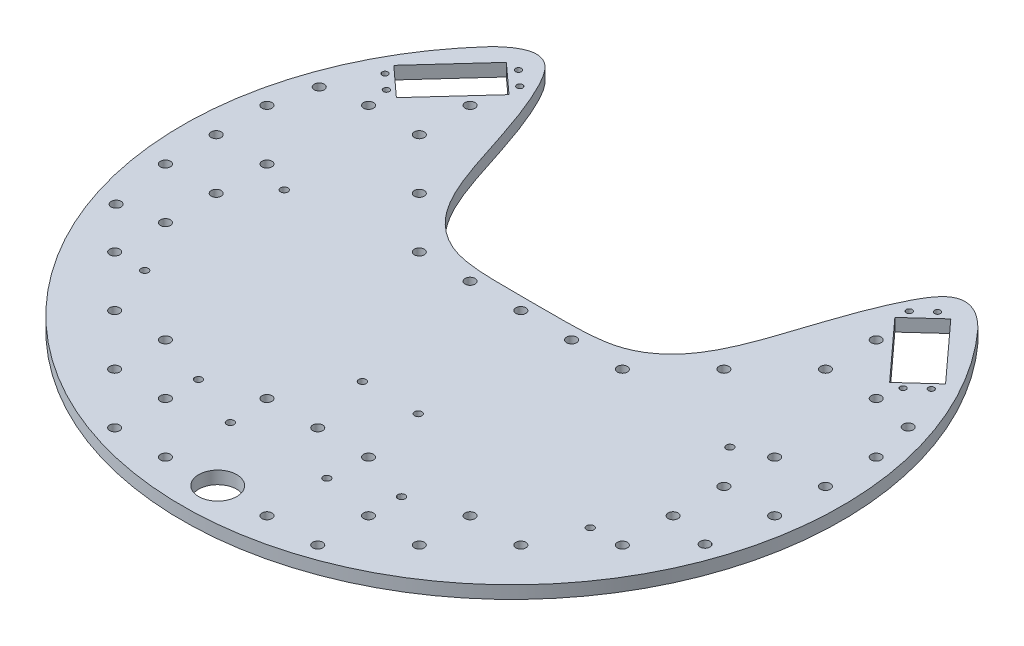
from build123d import *

# Parameters (mm, degrees)
SKETCH1_R                      = 164.975
BOSS_EXTRUDE1_DEPTH            = 6.35
F_6_CLEARANCE_HOLE1_D          = 3.6576
CUT_EXTRUDE1_START             = -6.35
CUT_EXTRUDE1_DEPTH             = 6.35
F_6_CLEARANCE_HOLE2_D          = 3.6576
F_6_CLEARANCE_HOLE2_DEPTH      = 25.4
F_6_CLEARANCE_HOLE2_TIP        = 1.0988539
F_10_CLEARANCE_HOLE3_D         = 4.9784
CUT_EXTRUDE2_DEPTH             = 234.396280641
F_4_CLEARANCE_HOLE1_AT_2_COUNT = 2
F_4_CLEARANCE_HOLE1_AT_2_PITCH = 10
F_4_CLEARANCE_HOLE1_AT_3_COUNT = 2
F_4_CLEARANCE_HOLE1_AT_3_PITCH = 48.306392952
F_4_CLEARANCE_HOLE1_AT_4_COUNT = 2
F_4_CLEARANCE_HOLE1_AT_4_PITCH = 47.26
F_6_CLEARANCE_HOLE5_D          = 3.6576
F_6_CLEARANCE_HOLE5_DEPTH      = 9.906
F_6_CLEARANCE_HOLE5_TIP        = 1.0988539
LPATTERN1_COUNT                = 7
LPATTERN1_PITCH                = 25.4
LPATTERN1_COUNT_DIR2           = 7
LPATTERN1_PITCH_DIR2           = 25.4
LPATTERN3_COUNT                = 4
LPATTERN3_PITCH                = 25.4
LPATTERN3_COUNT_DIR2           = 7
LPATTERN3_PITCH_DIR2           = 25.4
SKETCH26_R                     = 9.525
CUT_EXTRUDE3_DEPTH             = 234.396280641


# Read off the part's stored shape, not the designer's step: Cut-Extrude1
with BuildPart() as part:
    # Sketch1 → Boss-Extrude1 (new body)
    with BuildSketch(Plane(origin=(0, 0, 0), x_dir=(1, 0, 0), z_dir=(0, 1, 0))):
        with Locations(Location((0, 0, 0), (0, 0, 270))):
            Circle(SKETCH1_R)
    extrude(amount=BOSS_EXTRUDE1_DEPTH)

    # #6 Clearance Hole1 (through all)
    with Locations(Plane(origin=(111.465, 0, 2.54), x_dir=(0, 0, -1), z_dir=(0, -1, 0))):
        with Locations((0, 0), (-69.85, 0), (-69.85, -222.93), (0, -222.93)):
            Hole(F_6_CLEARANCE_HOLE1_D / 2)

    # Cut-Extrude1 outline → Cut-Extrude1 (cut)
    with BuildSketch(Plane(origin=(0, 6.35, 0), x_dir=(1, 0, 0), z_dir=(0, 1, 0)).offset(CUT_EXTRUDE1_START)):
        with BuildLine():
            add(Edge.make_bspline(
                [(-121.995341632, 111.058035482), (-113.827078604, 119.195529615), (-102.201033376, 123.818897159), (-77.69847521, 78.016737099), (-72.90657281, 34.879062258), (-40.627849609, 10.287477897), (-25.130427141, 10.681054333), (25.130427141, 10.681054333), (40.627849609, 10.287477897), (72.90657281, 34.879062258), (77.69847521, 78.016737099), (102.201033376, 123.818897159), (113.827078604, 119.195529615), (121.995341632, 111.058035482)],
                knots=[0, 0, 0, 0, 0.147171476, 0.22252378, 0.623698123, 0.698492612, 0.920321881, 0.920321881, 1.14215115, 1.216945639, 1.618119982, 1.693472286, 1.840643762, 1.840643762, 1.840643762, 1.840643762], degree=3))
            ThreePointArc((121.995341632, 111.058035482), (0, 164.975), (-121.995341632, 111.058035482))
        make_face()
    extrude(amount=CUT_EXTRUDE1_DEPTH, mode=Mode.SUBTRACT)

    # #6 Clearance Hole2
    with Locations(Plane(origin=(50.8, 6.35, 106.158945667), x_dir=(0, 0, 1), z_dir=(0, 1, 0))):
        with Locations((0, 0), (0, -101.6)):
            Hole(F_6_CLEARANCE_HOLE2_D / 2, depth=F_6_CLEARANCE_HOLE2_DEPTH)
            with Locations((0, 0, -(F_6_CLEARANCE_HOLE2_DEPTH + F_6_CLEARANCE_HOLE2_TIP / 2))):  # 118° drill point
                Cone(0, F_6_CLEARANCE_HOLE2_D / 2, F_6_CLEARANCE_HOLE2_TIP, mode=Mode.SUBTRACT)

    # #10 Clearance Hole3 (through all)
    with Locations(Plane(origin=(0, 6.35, 0), x_dir=(-1, 0, 0), z_dir=(0, 1, 0))):
        with Locations((147.32, -50.8), (147.32, 50.8), (-147.32, -50.8), (-147.32, 50.8)):
            Hole(F_10_CLEARANCE_HOLE3_D / 2)

    # Sketch20 → Cut-Extrude2 (cut, through all)
    with BuildSketch(Plane(origin=(0, 6.35, 0), x_dir=(1, 0, 0), z_dir=(0, 1, 0))):
        Polygon((-109.699539663, 80.469088467), (-96.519999999, 94.930350177), (-111.1630807, 108.275593959), (-124.593870916, 93.538647356), (-138.024661132, 78.801700753), (-130.703120781, 72.129078862), (-123.381580431, 65.456456971), align=None)
    cut_extrude2 = extrude(amount=-CUT_EXTRUDE2_DEPTH, mode=Mode.SUBTRACT)

    # Sketch21 → #4 Clearance Hole1 (revolve, cut)
    with BuildSketch(Plane(origin=(-104.804802432, 6.35, -107.979426396), x_dir=(0, 0, 1), z_dir=(1, 0, 0))):
        Polygon((0, 0), (0, 10.791187864), (1.4732, 9.906), (1.4732, 0), align=None)
    f_4_clearance_hole1 = revolve(axis=Axis((-104.804802432, 12.7, -107.979426396), (0, -1, 0)), mode=Mode.SUBTRACT)

    # #4 Clearance Hole1 at 2: #4 Clearance Hole1 ×2
    with Locations(*[Vector(0.739101589998467, 0, 0.6735939724060319) * (i * F_4_CLEARANCE_HOLE1_AT_2_PITCH) for i in range(1, F_4_CLEARANCE_HOLE1_AT_2_COUNT)]):
        add(f_4_clearance_hole1, mode=Mode.SUBTRACT)

    # #4 Clearance Hole1 at 3: #4 Clearance Hole1 ×2
    with Locations(*[Vector(-0.506000008329856, 0, 0.8625334727244999) * (i * F_4_CLEARANCE_HOLE1_AT_3_PITCH) for i in range(1, F_4_CLEARANCE_HOLE1_AT_3_COUNT)]):
        add(f_4_clearance_hole1, mode=Mode.SUBTRACT)

    # #4 Clearance Hole1 at 4: #4 Clearance Hole1 ×2
    with Locations(*[Vector(-0.6735939724060289, 0, 0.7391015899984696) * (i * F_4_CLEARANCE_HOLE1_AT_4_PITCH) for i in range(1, F_4_CLEARANCE_HOLE1_AT_4_COUNT)]):
        add(f_4_clearance_hole1, mode=Mode.SUBTRACT)

    # Mirror2: Cut-Extrude2, #4 Clearance Hole1 across plane
    add(cut_extrude2.mirror(Plane(origin=(0, 0, 0), x_dir=(0, 0, 1), z_dir=(1, 0, 0))), mode=Mode.SUBTRACT)
    add(f_4_clearance_hole1.mirror(Plane(origin=(0, 0, 0), x_dir=(0, 0, 1), z_dir=(1, 0, 0))), mode=Mode.SUBTRACT)

    # Mirror2 copy 1 sketch → Mirror2 copy 1 (revolve, cut)
    with BuildSketch(Plane(origin=(97.413786532, 6.35, -101.243486672), x_dir=(0, 0, 1), z_dir=(-1, 0, 0))):
        Polygon((0, 0), (0, -10.791187864), (1.4732, -9.906), (1.4732, 0), align=None)
    revolve(axis=Axis((97.413786532, 12.7, -101.243486672), (0, 1, 0)), mode=Mode.SUBTRACT)

    # Mirror2 copy 2 sketch → Mirror2 copy 2 (revolve, cut)
    with BuildSketch(Plane(origin=(129.247837668, 6.35, -66.313545529), x_dir=(0, 0, 1), z_dir=(-1, 0, 0))):
        Polygon((0, 0), (0, -10.791187864), (1.4732, -9.906), (1.4732, 0), align=None)
    revolve(axis=Axis((129.247837668, 12.7, -66.313545529), (0, 1, 0)), mode=Mode.SUBTRACT)

    # Mirror2 copy 3 sketch → Mirror2 copy 3 (revolve, cut)
    with BuildSketch(Plane(origin=(136.638853568, 6.35, -73.049485253), x_dir=(0, 0, 1), z_dir=(-1, 0, 0))):
        Polygon((0, 0), (0, -10.791187864), (1.4732, -9.906), (1.4732, 0), align=None)
    revolve(axis=Axis((136.638853568, 12.7, -73.049485253), (0, 1, 0)), mode=Mode.SUBTRACT)

    # #6 Clearance Hole5
    with Locations(Plane(origin=(-24.129999999, 6.35, 116.84), x_dir=(0, 0, 1), z_dir=(0, 1, 0))):
        with Locations((0, 0), (0, 48.26), (-50.8, 43.18), (-50.8, 15.24)):
            Hole(F_6_CLEARANCE_HOLE5_D / 2, depth=F_6_CLEARANCE_HOLE5_DEPTH)
            with Locations((0, 0, -(F_6_CLEARANCE_HOLE5_DEPTH + F_6_CLEARANCE_HOLE5_TIP / 2))):  # 118° drill point
                Cone(0, F_6_CLEARANCE_HOLE5_D / 2, F_6_CLEARANCE_HOLE5_TIP, mode=Mode.SUBTRACT)

    # Sketch25 → #10 Clearance Hole5 (revolve, cut)
    with BuildSketch(Plane(origin=(0, 6.35, -4.331054333), x_dir=(0, 0, 1), z_dir=(1, 0, 0))):
        Polygon((0, 0), (0, 11.401662253), (2.4892, 9.906), (2.4892, 0), align=None)
    f_10_clearance_hole5 = revolve(axis=Axis((0, 12.7, -4.331054333), (0, -1, 0)), mode=Mode.SUBTRACT)

    # LPattern1: 10 Clearance Hole5 7 × 7, 34 skipped
    with Locations(*[(j * LPATTERN1_PITCH_DIR2, 0, i * LPATTERN1_PITCH) for i in range(LPATTERN1_COUNT) for j in range(LPATTERN1_COUNT_DIR2) if (i, j) not in ((0, 0), (0, 1), (0, 2), (0, 3), (0, 4), (1, 0), (1, 1), (1, 2), (1, 3), (1, 4), (2, 0), (2, 1), (2, 2), (2, 3), (2, 4), (2, 6), (3, 0), (3, 1), (3, 2), (3, 3), (3, 4), (3, 6), (4, 2), (4, 5), (4, 6), (5, 0), (5, 1), (5, 4), (5, 5), (5, 6), (6, 0), (6, 3), (6, 4), (6, 5), (6, 6))]):
        add(f_10_clearance_hole5, mode=Mode.SUBTRACT)

    # LPattern3: 10 Clearance Hole5 4 × 7, 18 skipped
    with Locations(*[(j * LPATTERN3_PITCH_DIR2, 0, -i * LPATTERN3_PITCH) for i in range(LPATTERN3_COUNT) for j in range(LPATTERN3_COUNT_DIR2) if (i, j) not in ((0, 0), (0, 3), (0, 4), (1, 0), (1, 1), (1, 2), (1, 4), (1, 5), (2, 0), (2, 1), (2, 2), (2, 3), (2, 6), (3, 0), (3, 1), (3, 2), (3, 3), (3, 5), (3, 6))]):
        add(f_10_clearance_hole5, mode=Mode.SUBTRACT)

    # Mirror3 copy 1 sketch → Mirror3 copy 1 (revolve, cut)
    with BuildSketch(Plane(origin=(-127, 6.35, -4.331054333), x_dir=(0, 0, 1), z_dir=(-1, 0, 0))):
        Polygon((0, 0), (0, -11.401662253), (2.4892, -9.906), (2.4892, 0), align=None)
    revolve(axis=Axis((-127, 12.7, -4.331054333), (0, 1, 0)), mode=Mode.SUBTRACT)

    # Mirror3 copy 2 sketch → Mirror3 copy 2 (revolve, cut)
    with BuildSketch(Plane(origin=(-152.4, 6.35, -4.331054333), x_dir=(0, 0, 1), z_dir=(-1, 0, 0))):
        Polygon((0, 0), (0, -11.401662253), (2.4892, -9.906), (2.4892, 0), align=None)
    revolve(axis=Axis((-152.4, 12.7, -4.331054333), (0, 1, 0)), mode=Mode.SUBTRACT)

    # Mirror3 copy 3 sketch → Mirror3 copy 3 (revolve, cut)
    with BuildSketch(Plane(origin=(-127, 6.35, 21.068945667), x_dir=(0, 0, 1), z_dir=(-1, 0, 0))):
        Polygon((0, 0), (0, -11.401662253), (2.4892, -9.906), (2.4892, 0), align=None)
    revolve(axis=Axis((-127, 12.7, 21.068945667), (0, 1, 0)), mode=Mode.SUBTRACT)

    # Mirror3 copy 4 sketch → Mirror3 copy 4 (revolve, cut)
    with BuildSketch(Plane(origin=(-152.4, 6.35, 21.068945667), x_dir=(0, 0, 1), z_dir=(-1, 0, 0))):
        Polygon((0, 0), (0, -11.401662253), (2.4892, -9.906), (2.4892, 0), align=None)
    revolve(axis=Axis((-152.4, 12.7, 21.068945667), (0, 1, 0)), mode=Mode.SUBTRACT)

    # Mirror3 copy 5 sketch → Mirror3 copy 5 (revolve, cut)
    with BuildSketch(Plane(origin=(-127, 6.35, 46.468945667), x_dir=(0, 0, 1), z_dir=(-1, 0, 0))):
        Polygon((0, 0), (0, -11.401662253), (2.4892, -9.906), (2.4892, 0), align=None)
    revolve(axis=Axis((-127, 12.7, 46.468945667), (0, 1, 0)), mode=Mode.SUBTRACT)

    # Mirror3 copy 6 sketch → Mirror3 copy 6 (revolve, cut)
    with BuildSketch(Plane(origin=(-127, 6.35, 71.868945667), x_dir=(0, 0, 1), z_dir=(-1, 0, 0))):
        Polygon((0, 0), (0, -11.401662253), (2.4892, -9.906), (2.4892, 0), align=None)
    revolve(axis=Axis((-127, 12.7, 71.868945667), (0, 1, 0)), mode=Mode.SUBTRACT)

    # Mirror3 copy 7 sketch → Mirror3 copy 7 (revolve, cut)
    with BuildSketch(Plane(origin=(0, 6.35, 97.268945667), x_dir=(0, 0, 1), z_dir=(-1, 0, 0))):
        Polygon((0, 0), (0, -11.401662253), (2.4892, -9.906), (2.4892, 0), align=None)
    revolve(axis=Axis((0, 12.7, 97.268945667), (0, 1, 0)), mode=Mode.SUBTRACT)

    # Mirror3 copy 8 sketch → Mirror3 copy 8 (revolve, cut)
    with BuildSketch(Plane(origin=(-25.4, 6.35, 97.268945667), x_dir=(0, 0, 1), z_dir=(-1, 0, 0))):
        Polygon((0, 0), (0, -11.401662253), (2.4892, -9.906), (2.4892, 0), align=None)
    revolve(axis=Axis((-25.4, 12.7, 97.268945667), (0, 1, 0)), mode=Mode.SUBTRACT)

    # Mirror3 copy 9 sketch → Mirror3 copy 9 (revolve, cut)
    with BuildSketch(Plane(origin=(-76.2, 6.35, 97.268945667), x_dir=(0, 0, 1), z_dir=(-1, 0, 0))):
        Polygon((0, 0), (0, -11.401662253), (2.4892, -9.906), (2.4892, 0), align=None)
    revolve(axis=Axis((-76.2, 12.7, 97.268945667), (0, 1, 0)), mode=Mode.SUBTRACT)

    # Mirror3 copy 10 sketch → Mirror3 copy 10 (revolve, cut)
    with BuildSketch(Plane(origin=(-101.6, 6.35, 97.268945667), x_dir=(0, 0, 1), z_dir=(-1, 0, 0))):
        Polygon((0, 0), (0, -11.401662253), (2.4892, -9.906), (2.4892, 0), align=None)
    revolve(axis=Axis((-101.6, 12.7, 97.268945667), (0, 1, 0)), mode=Mode.SUBTRACT)

    # Mirror3 copy 11 sketch → Mirror3 copy 11 (revolve, cut)
    with BuildSketch(Plane(origin=(-50.8, 6.35, 122.668945667), x_dir=(0, 0, 1), z_dir=(-1, 0, 0))):
        Polygon((0, 0), (0, -11.401662253), (2.4892, -9.906), (2.4892, 0), align=None)
    revolve(axis=Axis((-50.8, 12.7, 122.668945667), (0, 1, 0)), mode=Mode.SUBTRACT)

    # Mirror3 copy 12 sketch → Mirror3 copy 12 (revolve, cut)
    with BuildSketch(Plane(origin=(-76.2, 6.35, 122.668945667), x_dir=(0, 0, 1), z_dir=(-1, 0, 0))):
        Polygon((0, 0), (0, -11.401662253), (2.4892, -9.906), (2.4892, 0), align=None)
    revolve(axis=Axis((-76.2, 12.7, 122.668945667), (0, 1, 0)), mode=Mode.SUBTRACT)

    # Mirror3 copy 13 sketch → Mirror3 copy 13 (revolve, cut)
    with BuildSketch(Plane(origin=(-25.4, 6.35, 148.068945667), x_dir=(0, 0, 1), z_dir=(-1, 0, 0))):
        Polygon((0, 0), (0, -11.401662253), (2.4892, -9.906), (2.4892, 0), align=None)
    revolve(axis=Axis((-25.4, 12.7, 148.068945667), (0, 1, 0)), mode=Mode.SUBTRACT)

    # Mirror3 copy 14 sketch → Mirror3 copy 14 (revolve, cut)
    with BuildSketch(Plane(origin=(-50.8, 6.35, 148.068945667), x_dir=(0, 0, 1), z_dir=(-1, 0, 0))):
        Polygon((0, 0), (0, -11.401662253), (2.4892, -9.906), (2.4892, 0), align=None)
    revolve(axis=Axis((-50.8, 12.7, 148.068945667), (0, 1, 0)), mode=Mode.SUBTRACT)

    # Mirror3 copy 15 sketch → Mirror3 copy 15 (revolve, cut)
    with BuildSketch(Plane(origin=(0, 6.35, -4.331054333), x_dir=(0, 0, 1), z_dir=(-1, 0, 0))):
        Polygon((0, 0), (0, -11.401662253), (2.4892, -9.906), (2.4892, 0), align=None)
    revolve(axis=Axis((0, 12.7, -4.331054333), (0, 1, 0)), mode=Mode.SUBTRACT)

    # Mirror3 copy 16 sketch → Mirror3 copy 16 (revolve, cut)
    with BuildSketch(Plane(origin=(-25.4, 6.35, -4.331054333), x_dir=(0, 0, 1), z_dir=(-1, 0, 0))):
        Polygon((0, 0), (0, -11.401662253), (2.4892, -9.906), (2.4892, 0), align=None)
    revolve(axis=Axis((-25.4, 12.7, -4.331054333), (0, 1, 0)), mode=Mode.SUBTRACT)

    # Mirror3 copy 17 sketch → Mirror3 copy 17 (revolve, cut)
    with BuildSketch(Plane(origin=(-50.8, 6.35, -4.331054333), x_dir=(0, 0, 1), z_dir=(-1, 0, 0))):
        Polygon((0, 0), (0, -11.401662253), (2.4892, -9.906), (2.4892, 0), align=None)
    revolve(axis=Axis((-50.8, 12.7, -4.331054333), (0, 1, 0)), mode=Mode.SUBTRACT)

    # Mirror3 copy 18 sketch → Mirror3 copy 18 (revolve, cut)
    with BuildSketch(Plane(origin=(-127, 6.35, -4.331054333), x_dir=(0, 0, 1), z_dir=(-1, 0, 0))):
        Polygon((0, 0), (0, -11.401662253), (2.4892, -9.906), (2.4892, 0), align=None)
    revolve(axis=Axis((-127, 12.7, -4.331054333), (0, 1, 0)), mode=Mode.SUBTRACT)

    # Mirror3 copy 19 sketch → Mirror3 copy 19 (revolve, cut)
    with BuildSketch(Plane(origin=(-152.4, 6.35, -4.331054333), x_dir=(0, 0, 1), z_dir=(-1, 0, 0))):
        Polygon((0, 0), (0, -11.401662253), (2.4892, -9.906), (2.4892, 0), align=None)
    revolve(axis=Axis((-152.4, 12.7, -4.331054333), (0, 1, 0)), mode=Mode.SUBTRACT)

    # Mirror3 copy 20 sketch → Mirror3 copy 20 (revolve, cut)
    with BuildSketch(Plane(origin=(-76.2, 6.35, -29.731054333), x_dir=(0, 0, 1), z_dir=(-1, 0, 0))):
        Polygon((0, 0), (0, -11.401662253), (2.4892, -9.906), (2.4892, 0), align=None)
    revolve(axis=Axis((-76.2, 12.7, -29.731054333), (0, 1, 0)), mode=Mode.SUBTRACT)

    # Mirror3 copy 21 sketch → Mirror3 copy 21 (revolve, cut)
    with BuildSketch(Plane(origin=(-152.4, 6.35, -29.731054333), x_dir=(0, 0, 1), z_dir=(-1, 0, 0))):
        Polygon((0, 0), (0, -11.401662253), (2.4892, -9.906), (2.4892, 0), align=None)
    revolve(axis=Axis((-152.4, 12.7, -29.731054333), (0, 1, 0)), mode=Mode.SUBTRACT)

    # Mirror3 copy 22 sketch → Mirror3 copy 22 (revolve, cut)
    with BuildSketch(Plane(origin=(-101.6, 6.35, -55.131054333), x_dir=(0, 0, 1), z_dir=(-1, 0, 0))):
        Polygon((0, 0), (0, -11.401662253), (2.4892, -9.906), (2.4892, 0), align=None)
    revolve(axis=Axis((-101.6, 12.7, -55.131054333), (0, 1, 0)), mode=Mode.SUBTRACT)

    # Mirror3 copy 23 sketch → Mirror3 copy 23 (revolve, cut)
    with BuildSketch(Plane(origin=(-127, 6.35, -55.131054333), x_dir=(0, 0, 1), z_dir=(-1, 0, 0))):
        Polygon((0, 0), (0, -11.401662253), (2.4892, -9.906), (2.4892, 0), align=None)
    revolve(axis=Axis((-127, 12.7, -55.131054333), (0, 1, 0)), mode=Mode.SUBTRACT)

    # Mirror3 copy 24 sketch → Mirror3 copy 24 (revolve, cut)
    with BuildSketch(Plane(origin=(-101.6, 6.35, -80.531054333), x_dir=(0, 0, 1), z_dir=(-1, 0, 0))):
        Polygon((0, 0), (0, -11.401662253), (2.4892, -9.906), (2.4892, 0), align=None)
    revolve(axis=Axis((-101.6, 12.7, -80.531054333), (0, 1, 0)), mode=Mode.SUBTRACT)

    # Mirror3 copy 25 sketch → Mirror3 copy 25 (revolve, cut)
    with BuildSketch(Plane(origin=(0, 6.35, -4.331054333), x_dir=(0, 0, 1), z_dir=(-1, 0, 0))):
        Polygon((0, 0), (0, -11.401662253), (2.4892, -9.906), (2.4892, 0), align=None)
    revolve(axis=Axis((0, 12.7, -4.331054333), (0, 1, 0)), mode=Mode.SUBTRACT)

    # Sketch26 → Cut-Extrude3 (cut, through all)
    with BuildSketch(Plane(origin=(0, 6.35, 0), x_dir=(1, 0, 0), z_dir=(0, 1, 0))):
        with Locations(Location((0, -147.32, 0), (0, 0, 270))):
            Circle(SKETCH26_R)
    extrude(amount=-CUT_EXTRUDE3_DEPTH, mode=Mode.SUBTRACT)


solid = part.part
